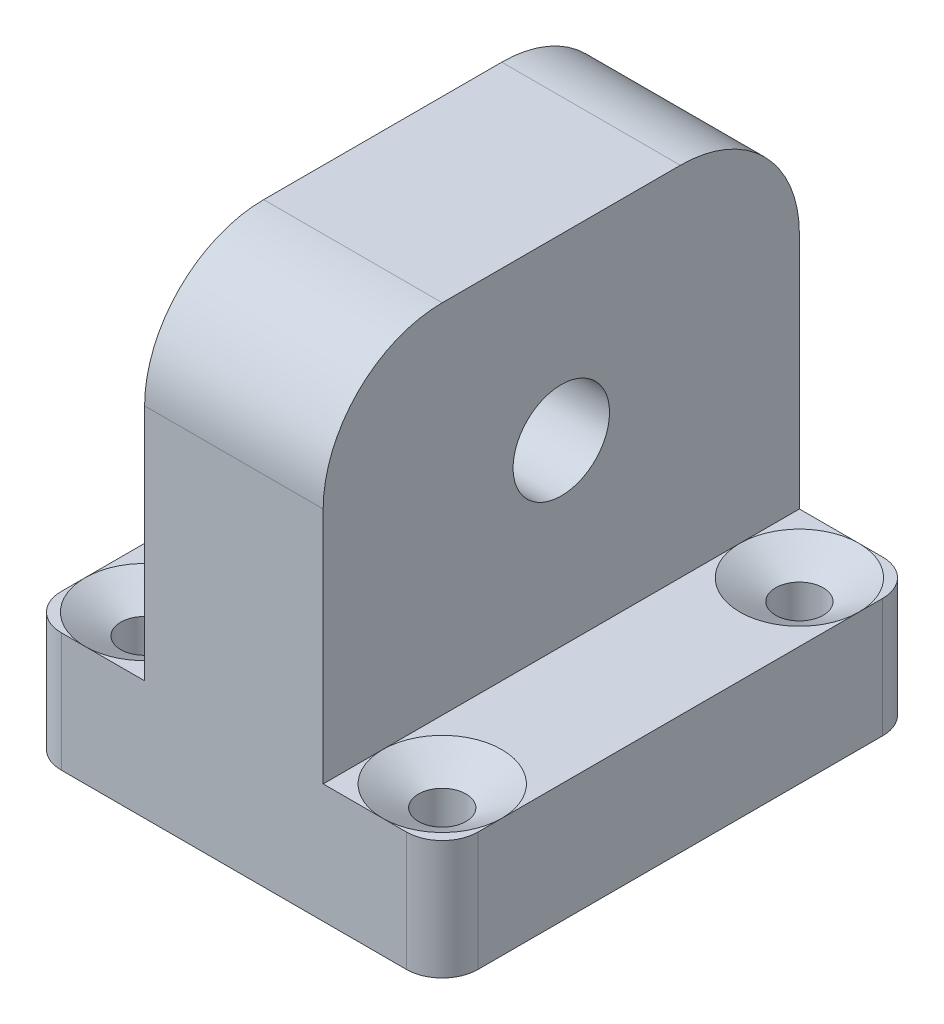
from build123d import *
from OCP.BRepFilletAPI import BRepFilletAPI_MakeChamfer

# Parameters (mm, degrees)
SKETCH_2_W          = 35
SKETCH_2_H          = 40
EXTRUDE_1_DEPTH     = 10
SKETCH_3_R          = 2
CUT_EXTRUDE_2_DEPTH = 10
SKETCH_4_W          = 15
SKETCH_4_H          = 40
EXTRUDE_2_DEPTH     = 30
SKETCH_5_R          = 7
CUT_EXTRUDE_3_DEPTH = 52.23475383
FILLET_2_R          = 3
FILLET_3_R          = 10
CHAMFER_1_SIZE      = 3
CHAMFER_1_SIZE_2    = 1.732050808
SKETCH_6_R          = 7
SKETCH_6_R_2        = 4.05
EXTRUDE_3_DEPTH     = 10


with BuildPart() as part:
    # 草图2 → 凸台-拉伸1 (new body)
    with BuildSketch(Plane(origin=(0, 0, 0), x_dir=(1, 0, 0), z_dir=(0, 1, 0))):
        Rectangle(SKETCH_2_W, SKETCH_2_H)
    extrude(amount=EXTRUDE_1_DEPTH)

    # 草图3 → 切除-拉伸2 (cut)
    with BuildSketch(Plane(origin=(0, 10, 0), x_dir=(1, 0, 0), z_dir=(0, 1, 0))):
        with Locations(Location((12.5, 15, 0), (0, 0, 270))):
            Circle(SKETCH_3_R)
        with Locations(Location((-12.5, 15, 0), (0, 0, 270))):
            Circle(SKETCH_3_R)
        with Locations(Location((-12.5, -15, 0), (0, 0, 270))):
            Circle(SKETCH_3_R)
        with Locations(Location((12.5, -15, 0), (0, 0, 270))):
            Circle(SKETCH_3_R)
    extrude(amount=-CUT_EXTRUDE_2_DEPTH, mode=Mode.SUBTRACT)

    # 草图4 → 凸台-拉伸2 (add)
    with BuildSketch(Plane(origin=(0, 10, 0), x_dir=(1, 0, 0), z_dir=(0, 1, 0))):
        Rectangle(SKETCH_4_W, SKETCH_4_H)
    extrude(amount=EXTRUDE_2_DEPTH)

    # 草图5 → 切除-拉伸3 (cut, through all)
    with BuildSketch(Plane(origin=(7.5, 0, 0), x_dir=(0, 0, -1), z_dir=(1, 0, 0))):
        with Locations((0, 25)):
            Circle(SKETCH_5_R)
    extrude(amount=-CUT_EXTRUDE_3_DEPTH, mode=Mode.SUBTRACT)

    # 圆角2
    fillet_2_edges = [part.edges().sort_by_distance(p)[0] for p in [
        (17.5, 5, -20),
        (-17.5, 5, -20),
        (-17.5, 5, 20),
        (17.5, 5, 20),
    ]]
    fillet(fillet_2_edges, radius=FILLET_2_R)

    # 圆角3
    fillet_3_edges = [part.edges().sort_by_distance(p)[0] for p in [
        (0, 40, 20),
        (0, 40, -20),
    ]]
    fillet(fillet_3_edges, radius=FILLET_3_R)

    # 倒角1
    chamfer_1_edges_1 = [part.edges().sort_by_distance(p)[0] for p in [
        (-12.5, 10, -17),
    ]]
    chamfer_1_side_1 = [part.faces().sort_by_distance(p)[0] for p in [
        (-12.5, 10, -17.034641016),
    ]]
    chamfer_1_edges_2 = [part.edges().sort_by_distance(p)[0] for p in [
        (-12.5, 10, 13),
    ]]
    chamfer_1_side_2 = [part.faces().sort_by_distance(p)[0] for p in [
        (-12.5, 10, 12.965358984),
    ]]
    chamfer_1_edges_3 = [part.edges().sort_by_distance(p)[0] for p in [
        (12.5, 10, 13),
    ]]
    chamfer_1_side_3 = [part.faces().sort_by_distance(p)[0] for p in [
        (12.5, 10, 12.965358984),
    ]]
    chamfer_1_edges_4 = [part.edges().sort_by_distance(p)[0] for p in [
        (12.5, 10, -17),
    ]]
    chamfer_1_side_4 = [part.faces().sort_by_distance(p)[0] for p in [
        (12.5, 10, -17.034641016),
    ]]
    chamfer_1 = BRepFilletAPI_MakeChamfer(part.part.solid().wrapped)
    for e in chamfer_1_edges_1:
        chamfer_1.Add(CHAMFER_1_SIZE - 0.0001, CHAMFER_1_SIZE_2 - 0.0001, e.wrapped, chamfer_1_side_1[0].wrapped)
    for e in chamfer_1_edges_2:
        chamfer_1.Add(CHAMFER_1_SIZE - 0.0001, CHAMFER_1_SIZE_2 - 0.0001, e.wrapped, chamfer_1_side_2[0].wrapped)
    for e in chamfer_1_edges_3:
        chamfer_1.Add(CHAMFER_1_SIZE - 0.0001, CHAMFER_1_SIZE_2 - 0.0001, e.wrapped, chamfer_1_side_3[0].wrapped)
    for e in chamfer_1_edges_4:
        chamfer_1.Add(CHAMFER_1_SIZE - 0.0001, CHAMFER_1_SIZE_2 - 0.0001, e.wrapped, chamfer_1_side_4[0].wrapped)
    add(Compound.cast(chamfer_1.Shape()), mode=Mode.REPLACE)  # a hair under: the kernel refuses the full size

    # 草图6 → 凸台-拉伸3 (add)
    with BuildSketch(Plane(origin=(7.5, 0, 0), x_dir=(0, 0, -1), z_dir=(1, 0, 0))):
        with Locations((0, 25)):
            Circle(SKETCH_6_R)
        with Locations((0, 25)):
            Circle(SKETCH_6_R_2, mode=Mode.SUBTRACT)
    extrude(amount=-EXTRUDE_3_DEPTH)


solid = part.part
